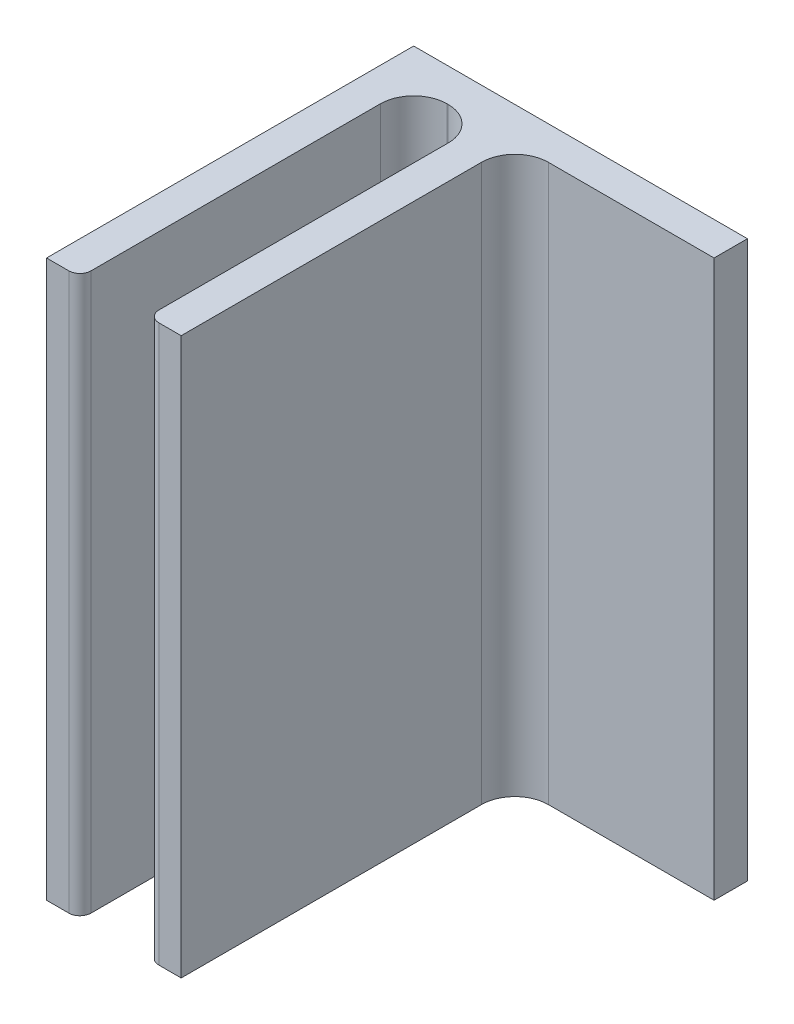
from build123d import *

# Parameters (mm, degrees)
SKETCH1_W           = 30
SKETCH1_H           = 50
BOSS_EXTRUDE1_DEPTH = 3
SKETCH2_W           = 3
SKETCH2_H           = 50
BOSS_EXTRUDE2_DEPTH = 30
FILLET2_R           = 3
FILLET3_R           = 1


with BuildPart() as part:
    # Sketch1 → Boss-Extrude1 (new body)
    with BuildSketch(Plane.XY):
        with Locations((15, 25)):
            Rectangle(SKETCH1_W, SKETCH1_H)
    extrude(amount=BOSS_EXTRUDE1_DEPTH)

    # Sketch2 → Boss-Extrude2 (add)
    with BuildSketch(Plane.XY.offset(3)):
        with Locations((1.5, 25)):
            Rectangle(SKETCH2_W, SKETCH2_H)
        with Locations((10.6, 25)):
            Rectangle(SKETCH2_W, SKETCH2_H)
    extrude(amount=BOSS_EXTRUDE2_DEPTH)

    # Fillet2
    fillet2_edges = [part.edges().sort_by_distance(p)[0] for p in [
        (12.1, 25, 3),
        (3, 25, 3),
        (9.1, 25, 3),
    ]]
    fillet(fillet2_edges, radius=FILLET2_R)

    # Fillet3
    fillet3_edges = [part.edges().sort_by_distance(p)[0] for p in [
        (9.1, 25, 33),
        (3, 25, 33),
    ]]
    fillet(fillet3_edges, radius=FILLET3_R)


solid = part.part
